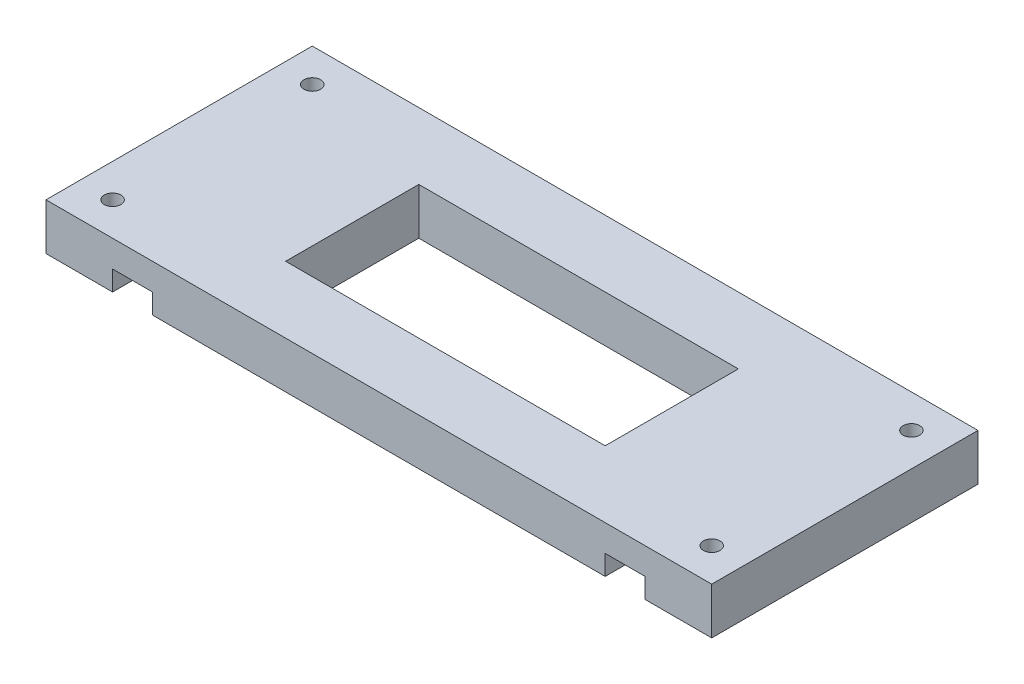
from build123d import *

# Parameters (mm, degrees)
BOSS_EXTRU_1_DEPTH      = 40
ENL_V_MAT_EXTRU_1_REACH = 109.931
ESQUISSE2_W             = 48
ESQUISSE2_H             = 20
ENL_V_MAT_EXTRU_2_REACH = 109.931
ESQUISSE3_R             = 1.25


with BuildPart() as part:
    # Esquisse1 → Boss.-Extru.1 (new body)
    with BuildSketch(Plane.XY):
        Polygon((0, 0), (10, 0), (10, 3), (16, 3), (16, 0), (84, 0), (84, 3), (90, 3), (90, 0), (100, 0), (100, 7), (0, 7), align=None)
    extrude(amount=BOSS_EXTRU_1_DEPTH)

    # Esquisse2 → Enlèv. mat.-Extru.1 (cut, up to next)
    with BuildSketch(Plane(origin=(0, 7, 0), x_dir=(1, 0, 0), z_dir=(0, 1, 0)), mode=Mode.PRIVATE) as enl_v_mat_extru_1_sk1:
        with Locations((50, -20)):
            Rectangle(ESQUISSE2_W, ESQUISSE2_H)
    enl_v_mat_extru_1_tool1 = extrude(enl_v_mat_extru_1_sk1.sketch, amount=-ENL_V_MAT_EXTRU_1_REACH, mode=Mode.PRIVATE) & part.part
    add(enl_v_mat_extru_1_tool1.solids().sort_by_distance((50, 7, 20))[0], mode=Mode.SUBTRACT)

    # Esquisse3 → Enlèv. mat.-Extru.2 (cut, up to next)
    with BuildSketch(Plane.XZ, mode=Mode.PRIVATE) as enl_v_mat_extru_2_sk1:
        with Locations((5, 35)):
            Circle(ESQUISSE3_R)
    enl_v_mat_extru_2_tool1 = extrude(enl_v_mat_extru_2_sk1.sketch, amount=-ENL_V_MAT_EXTRU_2_REACH, mode=Mode.PRIVATE) & part.part
    # Esquisse3 → Enlèv. mat.-Extru.2 (cut, up to next)
    with BuildSketch(Plane.XZ, mode=Mode.PRIVATE) as enl_v_mat_extru_2_sk2:
        with Locations((5, 5)):
            Circle(ESQUISSE3_R)
    enl_v_mat_extru_2_tool2 = extrude(enl_v_mat_extru_2_sk2.sketch, amount=-ENL_V_MAT_EXTRU_2_REACH, mode=Mode.PRIVATE) & part.part
    # Esquisse3 → Enlèv. mat.-Extru.2 (cut, up to next)
    with BuildSketch(Plane.XZ, mode=Mode.PRIVATE) as enl_v_mat_extru_2_sk3:
        with Locations((95, 35)):
            Circle(ESQUISSE3_R)
    enl_v_mat_extru_2_tool3 = extrude(enl_v_mat_extru_2_sk3.sketch, amount=-ENL_V_MAT_EXTRU_2_REACH, mode=Mode.PRIVATE) & part.part
    # Esquisse3 → Enlèv. mat.-Extru.2 (cut, up to next)
    with BuildSketch(Plane.XZ, mode=Mode.PRIVATE) as enl_v_mat_extru_2_sk4:
        with Locations((95, 5)):
            Circle(ESQUISSE3_R)
    enl_v_mat_extru_2_tool4 = extrude(enl_v_mat_extru_2_sk4.sketch, amount=-ENL_V_MAT_EXTRU_2_REACH, mode=Mode.PRIVATE) & part.part
    add(enl_v_mat_extru_2_tool1.solids().sort_by_distance((5, 0, 35))[0], mode=Mode.SUBTRACT)
    add(enl_v_mat_extru_2_tool2.solids().sort_by_distance((5, 0, 5))[0], mode=Mode.SUBTRACT)
    add(enl_v_mat_extru_2_tool3.solids().sort_by_distance((95, 0, 35))[0], mode=Mode.SUBTRACT)
    add(enl_v_mat_extru_2_tool4.solids().sort_by_distance((95, 0, 5))[0], mode=Mode.SUBTRACT)


solid = part.part
